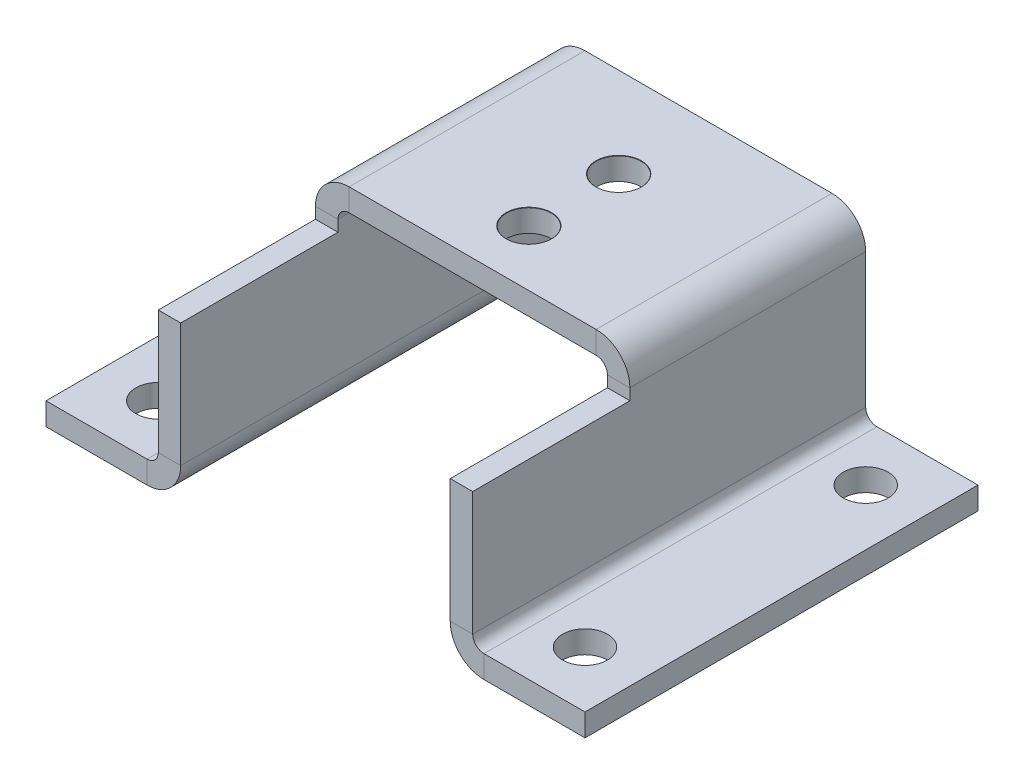
from build123d import *

# Parameters (mm, degrees)
BASE_FLANGE1_DEPTH                 = 35
SKETCH10_W                         = 28
SKETCH10_H                         = 14
CUT_EXTRUDE1_DEPTH                 = 4
F_4_0_4_DIAMETER_HOLE1_D           = 4
F_4_0_4_DIAMETER_HOLE1_CSINK_D     = 4.05
F_4_0_4_DIAMETER_HOLE1_CSINK_ANGLE = 90
SCALE1_SCALE                       = 1.5


# Sheet-metal steps are written as plain solids
with BuildPart() as part:
    # Sketch1 → Base-Flange1 (new body)
    with BuildSketch(Plane.XY):
        with BuildLine():
            Line((0, 0), (-9, 0))
            ThreePointArc((-9, 0), (-11.121320344, 0.878679656), (-12, 3))
            Line((-12, 3), (-12, 15))
            ThreePointArc((-12, 15), (-12.292893219, 15.707106781), (-13, 16))
            Line((-13, 16), (-35, 16))
            ThreePointArc((-35, 16), (-35.707106781, 15.707106781), (-36, 15))
            Line((-36, 15), (-36, 3))
            ThreePointArc((-36, 3), (-36.878679656, 0.878679656), (-39, 0))
            Line((-39, 0), (-48, 0))
            Line((-48, 0), (-48, 2))
            Line((-48, 2), (-39, 2))
            ThreePointArc((-39, 2), (-38.292893219, 2.292893219), (-38, 3))
            Line((-38, 3), (-38, 15))
            ThreePointArc((-38, 15), (-37.121320344, 17.121320344), (-35, 18))
            Line((-35, 18), (-13, 18))
            ThreePointArc((-13, 18), (-10.878679656, 17.121320344), (-10, 15))
            Line((-10, 15), (-10, 3))
            ThreePointArc((-10, 3), (-9.707106781, 2.292893219), (-9, 2))
            Line((-9, 2), (0, 2))
            Line((0, 2), (0, 0))
        make_face()
    extrude(amount=-BASE_FLANGE1_DEPTH)

    # Sketch10 → Cut-Extrude1 (cut)
    with BuildSketch(Plane(origin=(0, 18, 0), x_dir=(1, 0, 0), z_dir=(0, 1, 0))):
        with Locations((-24, 7)):
            Rectangle(SKETCH10_W, SKETCH10_H)
    extrude(amount=-CUT_EXTRUDE1_DEPTH, mode=Mode.SUBTRACT)

    # Ø4.0 (4) Diameter Hole1 (through all)
    with Locations(Plane(origin=(0, 18, 0), x_dir=(1, 0, 0), z_dir=(0, 1, 0))):
        with Locations((-24, 27), (-24, 19), (-43, 30), (-43, 5), (-5, 30), (-5, 5)):
            CounterSinkHole(F_4_0_4_DIAMETER_HOLE1_D / 2, F_4_0_4_DIAMETER_HOLE1_CSINK_D / 2, counter_sink_angle=F_4_0_4_DIAMETER_HOLE1_CSINK_ANGLE)


with BuildPart() as part_1:
    # Scale1: scaled about (-24, 8.107482912, -19.478199083)
    add(part.part.scale(SCALE1_SCALE).moved(Location((12, -4.053741456, 9.739099541))))


solid = part_1.part
